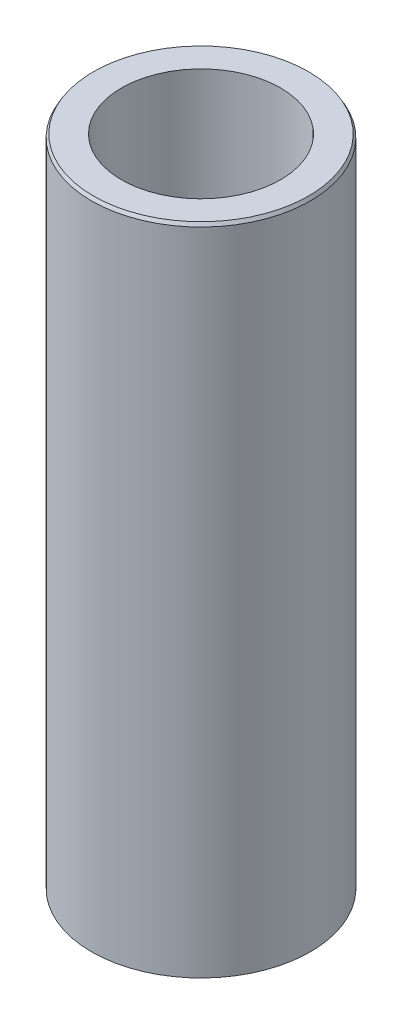
from build123d import *
from OCP.BRepFilletAPI import BRepFilletAPI_MakeChamfer

# Parameters (mm, degrees)
SKETCH1_R           = 52.5
BOSS_EXTRUDE1_DEPTH = 314.207176711
SKETCH2_R           = 38.145913246
CUT_EXTRUDE1_DEPTH  = 323.860108865
CHAMFER1_SIZE       = 1.571098689
CHAMFER1_SIZE2      = 0.907074251


with BuildPart() as part:
    # Sketch1 → Boss-Extrude1 (new body)
    with BuildSketch(Plane(origin=(0, 0, 0), x_dir=(1, 0, 0), z_dir=(0, 1, 0))):
        Circle(SKETCH1_R)
    extrude(amount=BOSS_EXTRUDE1_DEPTH)

    # Sketch2 → Cut-Extrude1 (cut, through all)
    with BuildSketch(Plane(origin=(0, 0, 0), x_dir=(1, 0, 0), z_dir=(0, 1, 0))):
        Circle(SKETCH2_R)
    extrude(amount=CUT_EXTRUDE1_DEPTH, mode=Mode.SUBTRACT)

    # Chamfer1: one chamfer whose edges measure the first distance from different faces: ONE call of the kernel's chamfer builder (chamfer() names one face for all edges)
    chamfer1_edges_1 = [part.edges().sort_by_distance(p)[0] for p in [
        (-52.5, 314.207176711, 0),
    ]]
    chamfer1_side_1 = [part.faces().sort_by_distance(p)[0] for p in [
        (-52.5, 157.103588355, 0),
    ]]
    chamfer1_edges_2 = [part.edges().sort_by_distance(p)[0] for p in [
        (-52.5, 0, 0),
    ]]
    chamfer1_side_2 = [part.faces().sort_by_distance(p)[0] for p in [
        (-51.01507576, 0, 0),
    ]]
    chamfer1 = BRepFilletAPI_MakeChamfer(part.part.solid().wrapped)
    for e in chamfer1_edges_1:
        chamfer1.Add(CHAMFER1_SIZE, CHAMFER1_SIZE2, e.wrapped, chamfer1_side_1[0].wrapped)  # the first distance lies on this face
    for e in chamfer1_edges_2:
        chamfer1.Add(CHAMFER1_SIZE, CHAMFER1_SIZE2, e.wrapped, chamfer1_side_2[0].wrapped)  # the first distance lies on this face
    add(Compound.cast(chamfer1.Shape()), mode=Mode.REPLACE)


solid = part.part
